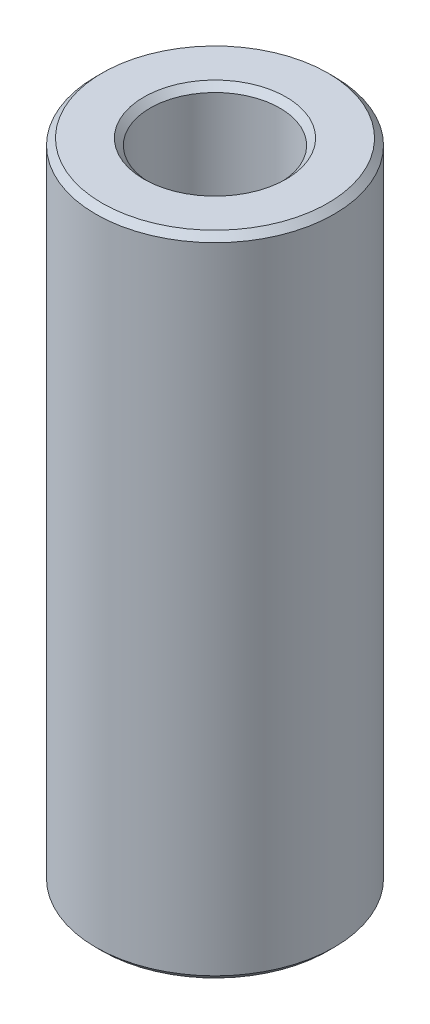
from build123d import *

# Parameters (mm, degrees)
SKETCH1_R           = 57.5
BOSS_EXTRUDE1_DEPTH = 312.498664851
SKETCH2_R           = 31.282593471
CUT_EXTRUDE1_DEPTH  = 323.905428158
CHAMFER1_SIZE       = 3.058747337


with BuildPart() as part:
    # Sketch1 → Boss-Extrude1 (new body)
    with BuildSketch(Plane(origin=(0, 0, 0), x_dir=(1, 0, 0), z_dir=(0, 1, 0))):
        Circle(SKETCH1_R)
    extrude(amount=BOSS_EXTRUDE1_DEPTH)

    # Sketch2 → Cut-Extrude1 (cut, through all)
    with BuildSketch(Plane(origin=(0, 0, 0), x_dir=(1, 0, 0), z_dir=(0, 1, 0))):
        Circle(SKETCH2_R)
    extrude(amount=CUT_EXTRUDE1_DEPTH, mode=Mode.SUBTRACT)

    # Chamfer1
    chamfer1_edges = [part.edges().sort_by_distance(p)[0] for p in [
        (-31.282593471, 312.498664851, 0),
        (-31.282593471, 0, 0),
        (-57.5, 0, 0),
        (-57.5, 312.498664851, 0),
    ]]
    chamfer(chamfer1_edges, length=CHAMFER1_SIZE)


solid = part.part
